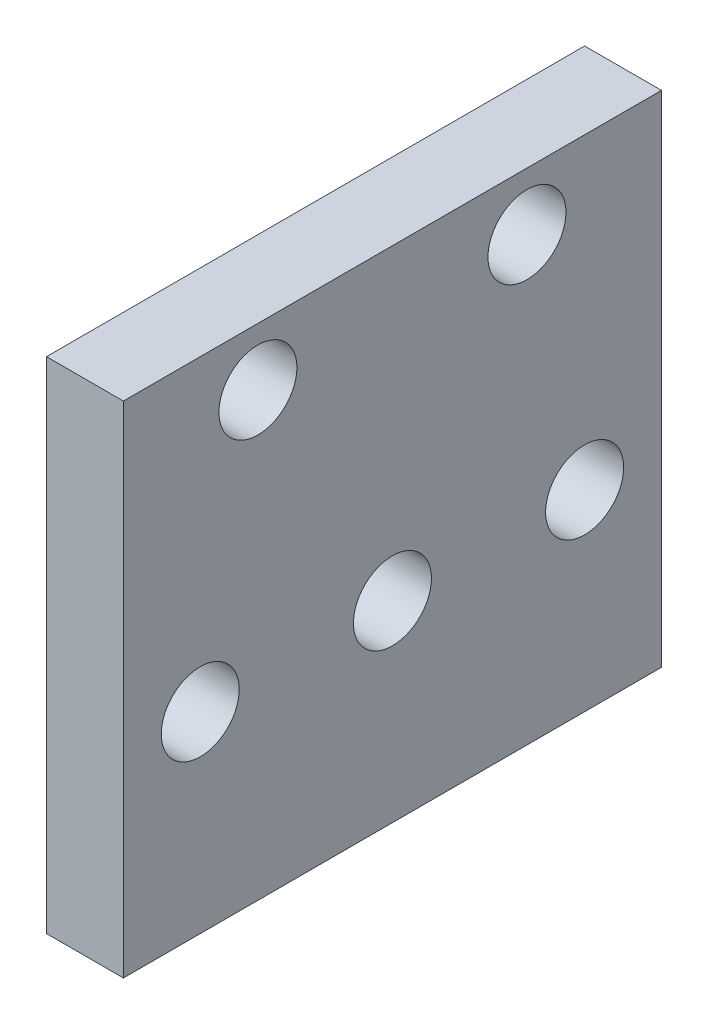
from build123d import *

# Parameters (mm, degrees)
SKETCH1_W           = 35.56
SKETCH1_H           = 33.02
BOSS_EXTRUDE1_DEPTH = 5.08
SKETCH2_R           = 2.5781
CUT_EXTRUDE1_DEPTH  = 25.789411046


with BuildPart() as part:
    # Sketch1 → Boss-Extrude1 (new body)
    with BuildSketch(Plane(origin=(0, 0, 0), x_dir=(0, 0, -1), z_dir=(1, 0, 0))):
        Rectangle(SKETCH1_W, SKETCH1_H)
    extrude(amount=BOSS_EXTRUDE1_DEPTH)

    # Sketch2 → Cut-Extrude1 (cut, through all)
    with BuildSketch(Plane(origin=(5.08, 0, 0), x_dir=(0, 0, -1), z_dir=(1, 0, 0))):
        with Locations((-8.89, 12.7)):
            Circle(SKETCH2_R)
        with Locations((8.89, 12.7)):
            Circle(SKETCH2_R)
        with Locations((-12.7, -3.81)):
            Circle(SKETCH2_R)
        with Locations((0, -3.81)):
            Circle(SKETCH2_R)
        with Locations((12.7, -3.81)):
            Circle(SKETCH2_R)
    extrude(amount=-CUT_EXTRUDE1_DEPTH, mode=Mode.SUBTRACT)


solid = part.part
